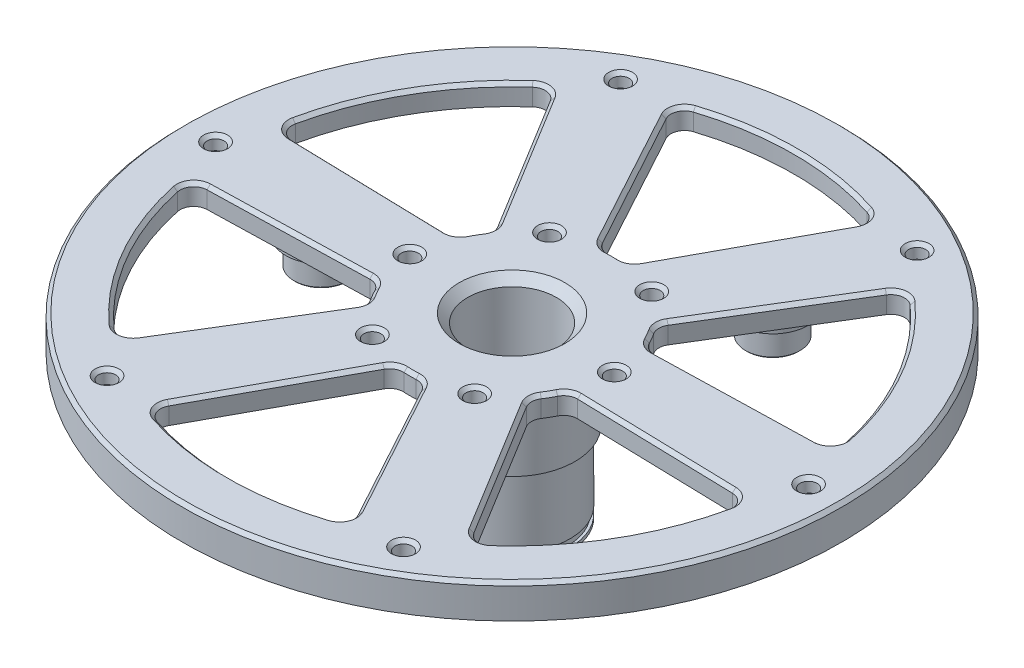
from build123d import *

# Parameters (mm, degrees)
SKETCH2_W                                     = 0.75
SKETCH2_H                                     = 12.25
CIRPATTERN2_COUNT                             = 3
CHAMFER1_SIZE                                 = 1.25
M3X0_5_TAPPED_HOLE_60_MM_DIAMETER_D           = 2.5
M3X0_5_TAPPED_HOLE_60_MM_DIAMETER_CSINK_D     = 3.5
M3X0_5_TAPPED_HOLE_60_MM_DIAMETER_CSINK_ANGLE = 90
CIRPATTERN3_COUNT                             = 6
CUT_EXTRUDE1_DEPTH                            = 72.270295355
CIRPATTERN4_COUNT                             = 6
CHAMFER2_SIZE                                 = 0.5
CHAMFER3_SIZE                                 = 0.5
SKETCH14_W                                    = 6.551993776
SKETCH14_H                                    = 1.1
CHAMFER4_SIZE                                 = 0.5
CHAMFER5_SIZE                                 = 0.2


with BuildPart() as part:
    # Sketch1 → Shaft (revolve)
    with BuildSketch(Plane.XY):
        Polygon((-6.5, 18.1), (-6.5, -1.95), (-4.5, -1.95), (-4.5, -3.95), (-6.6, -3.95), (-6.6, -6.45), (-8.48, -6.45), (-8.48, 18.1), align=None)
    revolve(axis=Axis((0, 0, 0), (0, -1, 0)))

    # Sketch2 → Revolve1 (revolve)
    with BuildSketch(Plane.XY):
        with Locations((-8.855, 11.975)):
            Rectangle(SKETCH2_W, SKETCH2_H)
    revolve(axis=Axis((0, 0, 0), (0, 1, 0)))



with BuildPart() as body_2:
    # Sketch4 → Revolve2 (revolve)
    with BuildSketch(Plane.XY):
        Polygon((-28, 12), (-28, 18.1), (-33.19, 18.1), (-33.19, 16), (-31.99, 16), (-31.99, 12), align=None)
    revolve(axis=Axis((-28, 12.136274552, 0), (0, -1, 0)))


with BuildPart() as cirpattern2_1:
    # CirPattern2: pattern copy
    add(body_2.part.rotate(Axis((0, 0, 0), (0, 1, 0)), 1 * 360 / CIRPATTERN2_COUNT))


with BuildPart() as cirpattern2_2:
    # CirPattern2: pattern copy
    add(body_2.part.rotate(Axis((0, 0, 0), (0, 1, 0)), 2 * 360 / CIRPATTERN2_COUNT))


with BuildPart() as part_1:
    add(part.part)

    add(body_2.part)  # Revolve3 merges body 2

    add(cirpattern2_1.part)  # Revolve3 merges CirPattern2_1

    add(cirpattern2_2.part)  # Revolve3 merges CirPattern2_2
    # Sketch8 → Revolve3 (revolve)
    with BuildSketch(Plane.XY):
        Polygon((-48.35, 20.1), (-6.5, 20.1), (-6.5, 17.1), (-42.519999369, 17.1), (-42.519999369, 18.1), (-47.35, 18.1), (-47.35, 15.15), (-48.35, 15.15), align=None)
    revolve(axis=Axis((0, 0, 0), (0, 1, 0)))

    # Chamfer1
    chamfer1_edges = [part_1.edges().sort_by_distance(p)[0] for p in [
        (6.5, 20.1, 0),
    ]]
    chamfer(chamfer1_edges, length=CHAMFER1_SIZE)

    # M3x0.5 Tapped Hole - 60 mm diameter (through all)
    with Locations(Plane(origin=(0, 20.1, 0), x_dir=(1, 0, 0), z_dir=(0, 1, 0))):
        with Locations((-15, 0), (-43.5, 0)):
            m3x0_5_tapped_hole_60_mm_diameter = CounterSinkHole(M3X0_5_TAPPED_HOLE_60_MM_DIAMETER_D / 2, M3X0_5_TAPPED_HOLE_60_MM_DIAMETER_CSINK_D / 2, counter_sink_angle=M3X0_5_TAPPED_HOLE_60_MM_DIAMETER_CSINK_ANGLE)

    # CirPattern3: M3x0.5 Tapped Hole - 60 mm diameter ×6 about axis
    cirpattern3_axis = Axis((0, 0, 0), (0, 1, 0))
    for i in range(1, CIRPATTERN3_COUNT):
        add(m3x0_5_tapped_hole_60_mm_diameter.rotate(cirpattern3_axis, i * 360 / CIRPATTERN3_COUNT), mode=Mode.SUBTRACT)

    # Sketch13 → Cut-Extrude1 (cut, through all)
    with BuildSketch(Plane(origin=(0, 0, 0), x_dir=(1, 0, 0), z_dir=(0, 1, 0))):
        with BuildLine():
            Line((-13.883389556, -36.479634299), (-2.757092363, -16.015247917))
            ThreePointArc((-2.757092363, -16.015247917), (-1.971072098, -15.222129456), (-0.882352941, -14.974025955))
            ThreePointArc((-0.882352941, -14.974025955), (0, -15), (0.882352941, -14.974025955))
            ThreePointArc((0.882352941, -14.974025955), (1.971072098, -15.222129456), (2.757092363, -16.015247917))
            Line((2.757092363, -16.015247917), (13.883389556, -36.479634299))
            ThreePointArc((13.883389556, -36.479634299), (13.983794699, -38.176368726), (12.742627419, -39.337614906))
            ThreePointArc((12.742627419, -39.337614906), (0, -41.35), (-12.742627419, -39.337614906))
            ThreePointArc((-12.742627419, -39.337614906), (-13.983794699, -38.176368726), (-13.883389556, -36.479634299))
        make_face()
    cut_extrude1 = extrude(amount=CUT_EXTRUDE1_DEPTH, mode=Mode.SUBTRACT)

    # CirPattern4: Cut-Extrude1 ×6 about axis
    cirpattern4_axis = Axis((0, 0, 0), (0, 1, 0))
    for i in range(1, CIRPATTERN4_COUNT):
        add(cut_extrude1.rotate(cirpattern4_axis, i * 360 / CIRPATTERN4_COUNT), mode=Mode.SUBTRACT)

    # Chamfer2
    chamfer2_edges = [part_1.edges().sort_by_distance(p)[0] for p in [
        (-26.891071264, 20.1, 5.918180517),
        (-40.05360249, 20.1, 6.977862912),
        (-14.168286857, 20.1, 5.904066218),
        (-12.990381057, 20.1, 7.5),
        (-26.069807791, 20.1, 31.198505813),
        (-12.197214759, 20.1, 9.318063238),
        (-18.570830304, 20.1, 20.329260591),
        (-8.32024096, 20.1, 26.247441108),
        (-13.983794699, 20.1, 38.176368726),
        (-1.971072098, 20.1, 15.222129456),
        (0, 20.1, 15),
        (13.983794699, 20.1, 38.176368726),
        (1.971072098, 20.1, 15.222129456),
        (8.32024096, 20.1, 26.247441108),
        (18.570830304, 20.1, 20.329260591),
        (26.069807791, 20.1, 31.198505813),
        (12.197214759, 20.1, 9.318063238),
        (12.990381057, 20.1, 7.5),
        (40.05360249, 20.1, 6.977862912),
        (14.168286857, 20.1, 5.904066218),
        (26.891071264, 20.1, 5.918180517),
        (26.891071264, 20.1, -5.918180517),
        (40.05360249, 20.1, -6.977862912),
        (14.168286857, 20.1, -5.904066218),
        (12.990381057, 20.1, -7.5),
        (26.069807791, 20.1, -31.198505813),
        (12.197214759, 20.1, -9.318063238),
        (18.570830304, 20.1, -20.329260591),
        (8.32024096, 20.1, -26.247441108),
        (13.983794699, 20.1, -38.176368726),
        (1.971072098, 20.1, -15.222129456),
        (0, 20.1, -15),
        (-13.983794699, 20.1, -38.176368726),
        (-1.971072098, 20.1, -15.222129456),
        (-8.32024096, 20.1, -26.247441108),
        (-26.891071264, 20.1, -5.918180517),
        (-14.168286857, 20.1, -5.904066218),
        (-40.05360249, 20.1, -6.977862912),
        (-12.990381057, 20.1, -7.5),
        (-12.197214759, 20.1, -9.318063238),
        (-26.069807791, 20.1, -31.198505813),
        (-18.570830304, 20.1, -20.329260591),
        (-35.810150446, 20.1, 20.675),
        (0, 20.1, 41.35),
        (35.810150446, 20.1, 20.675),
        (35.810150446, 20.1, -20.675),
        (0, 20.1, -41.35),
        (-35.810150446, 20.1, -20.675),
    ]]
    chamfer(chamfer2_edges, length=CHAMFER2_SIZE)

    # Chamfer3
    chamfer3_edges = [part_1.edges().sort_by_distance(p)[0] for p in [
        (48.35, 20.1, 0),
    ]]
    chamfer(chamfer3_edges, length=CHAMFER3_SIZE)

    # Sketch14 → Cut-Revolve1 (revolve, cut)
    with BuildSketch(Plane.XY):
        with Locations((-11.375996888, -4.9)):
            Rectangle(SKETCH14_W, SKETCH14_H)
    revolve(axis=Axis((0, 0, 0), (0, -1, 0)), mode=Mode.SUBTRACT)

    # Chamfer4
    chamfer4_edges = [part_1.edges().sort_by_distance(p)[0] for p in [
        (8.48, -6.45, 0),
    ]]
    chamfer(chamfer4_edges, length=CHAMFER4_SIZE)

    # Chamfer5
    chamfer5_edges = [part_1.edges().sort_by_distance(p)[0] for p in [
        (12.005, 12, -20.793269945),
        (12.005, 12, 20.793269945),
        (-24.01, 12, 0),
    ]]
    chamfer(chamfer5_edges, length=CHAMFER5_SIZE)


solid = part_1.part
